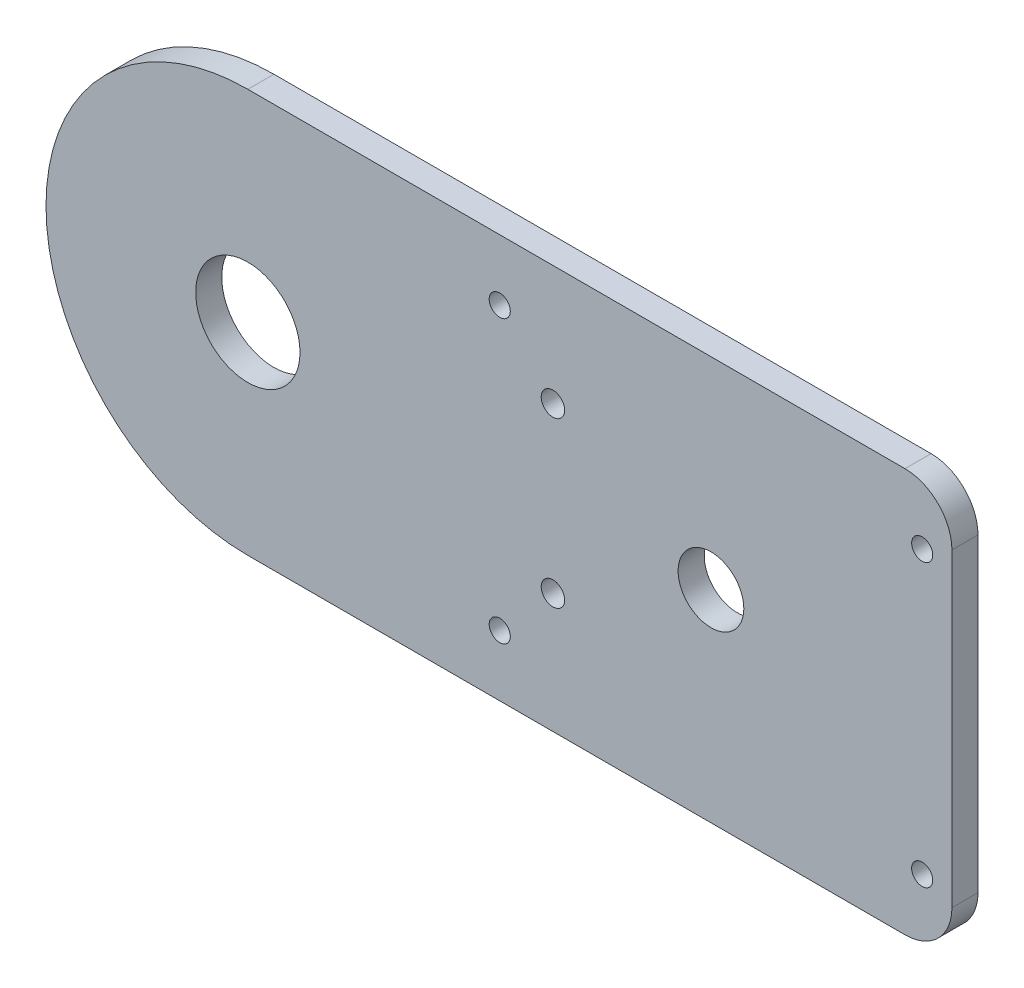
from build123d import *

# Parameters (mm, degrees)
SKETCH1_R           = 11.1125
BOSS_EXTRUDE1_DEPTH = 5.55625
SKETCH2_R           = 7.000000001
CUT_EXTRUDE1_DEPTH  = 5.55625
FILLET1_R           = 10
SKETCH3_R           = 2.250000001
CUT_EXTRUDE2_DEPTH  = 6.35
SKETCH4_R           = 2.5
CUT_EXTRUDE3_DEPTH  = 40


with BuildPart() as part:
    # Sketch1 → Boss-Extrude1 (new body)
    with BuildSketch(Plane.XY):
        with BuildLine():
            Line((-65, 43), (85, 43))
            Line((85, 43), (85, -43))
            Line((85, -43), (-65, -43))
            ThreePointArc((-65, -43), (-108, 0), (-65, 43))
        make_face()
        with Locations((-65, 0)):
            Circle(SKETCH1_R, mode=Mode.SUBTRACT)
    extrude(amount=BOSS_EXTRUDE1_DEPTH)

    # Sketch2 → Cut-Extrude1 (cut)
    with BuildSketch(Plane.XY.offset(5.55625)):
        with Locations((33.66639768, 0)):
            Circle(SKETCH2_R)
    extrude(amount=-CUT_EXTRUDE1_DEPTH, mode=Mode.SUBTRACT)

    # Fillet1
    fillet1_edges = [part.edges().sort_by_distance(p)[0] for p in [
        (85, -43, 2.778125),
        (85, 43, 2.778125),
    ]]
    fillet(fillet1_edges, radius=FILLET1_R)

    # Sketch3 → Cut-Extrude2 (cut)
    with BuildSketch(Plane.XY.offset(5.55625)):
        with Locations((78.66639768, 30)):
            Circle(SKETCH3_R)
        with Locations((78.66639768, -30)):
            Circle(SKETCH3_R)
        with Locations((-11.33360232, 30)):
            Circle(SKETCH3_R)
        with Locations((-11.33360232, -30)):
            Circle(SKETCH3_R)
    extrude(amount=-CUT_EXTRUDE2_DEPTH, mode=Mode.SUBTRACT)

    # Sketch4 → Cut-Extrude3 (cut)
    with BuildSketch(Plane.XY.offset(5.55625)):
        with Locations((0, 17.5)):
            Circle(SKETCH4_R)
        with Locations((0, -17.5)):
            Circle(SKETCH4_R)
    extrude(amount=-CUT_EXTRUDE3_DEPTH, mode=Mode.SUBTRACT)


solid = part.part
